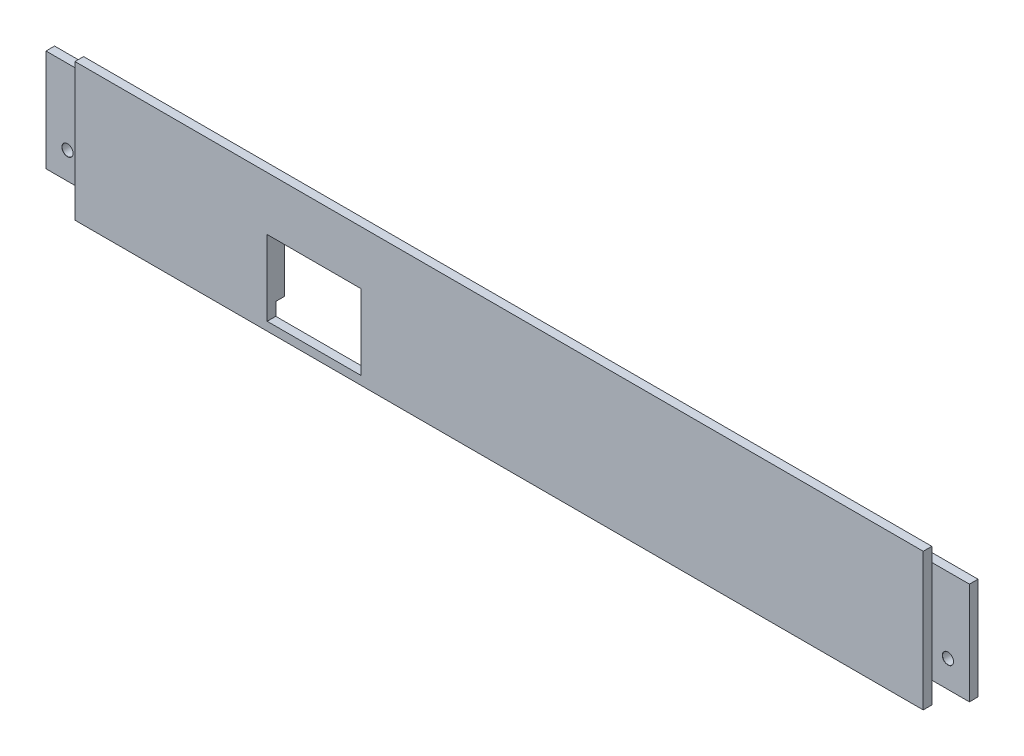
from build123d import *

# Parameters (mm, degrees)
SKETCH1_W                                = 158
SKETCH1_H                                = 25.6
BOSS_EXTRUDE1_DEPTH                      = 1.6
SKETCH2_W                                = 172
SKETCH2_H                                = 19
BOSS_EXTRUDE2_DEPTH                      = 1.6
TAP_DRILL_FOR_M2_5X0_45_TAP3_D           = 2.05
TAP_DRILL_FOR_M2_5X0_45_TAP3_CSINK_D     = 2.1
TAP_DRILL_FOR_M2_5X0_45_TAP3_CSINK_ANGLE = 90
SKETCH7_W                                = 8
SKETCH7_H                                = 7
SKETCH7_R                                = 1.3
BOSS_EXTRUDE3_DEPTH                      = 4
BOSS_EXTRUDE3_2_DEPTH                    = 4
CUT_EXTRUDE1_DEPTH                       = 91.001999978
CUT_EXTRUDE1_DEPTH_BACK                  = 91.001999978
SKETCH8_W                                = 17.5
SKETCH8_H                                = 14
FILLET1_R                                = 0.5


with BuildPart() as part:
    # Sketch1 → Boss-Extrude1 (new body)
    with BuildSketch(Plane.XY):
        with Locations((0, 12.8)):
            Rectangle(SKETCH1_W, SKETCH1_H)
    extrude(amount=BOSS_EXTRUDE1_DEPTH)

    # Sketch2 → Boss-Extrude2 (add)
    with BuildSketch(Plane.XY):
        with Locations((0, 13.5)):
            Rectangle(SKETCH2_W, SKETCH2_H)
    extrude(amount=-BOSS_EXTRUDE2_DEPTH)

    # Tap Drill for M2.5x0.45 Tap3 (through all)
    with Locations(Plane(origin=(-82, 9, 0), x_dir=(1, 0, 0), z_dir=(0, 0, 1))):
        with Locations((0, 0), (164, 0)):
            CounterSinkHole(TAP_DRILL_FOR_M2_5X0_45_TAP3_D / 2, TAP_DRILL_FOR_M2_5X0_45_TAP3_CSINK_D / 2, counter_sink_angle=TAP_DRILL_FOR_M2_5X0_45_TAP3_CSINK_ANGLE)

    # Sketch8 → Cut-Extrude1 (cut, two sides: drawn at the far end of the back side and taken through both)
    with BuildSketch(Plane.XY.offset(-CUT_EXTRUDE1_DEPTH_BACK)):
        with Locations((-34.45, 8.6)):
            Rectangle(SKETCH8_W, SKETCH8_H)
    extrude(amount=CUT_EXTRUDE1_DEPTH + CUT_EXTRUDE1_DEPTH_BACK, mode=Mode.SUBTRACT)


with BuildPart() as body_2:
    # Sketch7 → Boss-Extrude3 (new body)
    with BuildSketch(Plane(origin=(0, 1.6, 0), x_dir=(1, 0, 0), z_dir=(0, 1, 0))):
        with Locations((-56.9, 3.5)):
            Rectangle(SKETCH7_W, SKETCH7_H)
        with Locations((-56.9, 4.51)):
            Circle(SKETCH7_R, mode=Mode.SUBTRACT)
    extrude(amount=BOSS_EXTRUDE3_DEPTH)


with BuildPart() as body_3:
    # Sketch7 → Boss-Extrude3 2 (new body)
    with BuildSketch(Plane(origin=(0, 1.6, 0), x_dir=(1, 0, 0), z_dir=(0, 1, 0))):
        with Locations((66.9, 3.5)):
            Rectangle(SKETCH7_W, SKETCH7_H)
        with Locations((66.9, 4.51)):
            Circle(SKETCH7_R, mode=Mode.SUBTRACT)
    extrude(amount=BOSS_EXTRUDE3_2_DEPTH)


with BuildPart() as body_2_1:
    add(body_2.part)

    # Combine1: union body 3, part
    add(body_3.part)
    add(part.part)

    # Fillet1
    fillet1_edges = [body_2_1.edges().sort_by_distance(p)[0] for p in [
        (62.9, 4.8, -1.6),
        (66.9, 5.6, -1.6),
        (70.9, 4.8, -1.6),
        (-52.9, 4.8, -1.6),
        (-60.9, 4.8, -1.6),
        (-56.9, 5.6, -1.6),
    ]]
    fillet(fillet1_edges, radius=FILLET1_R)


solid = body_2_1.part
